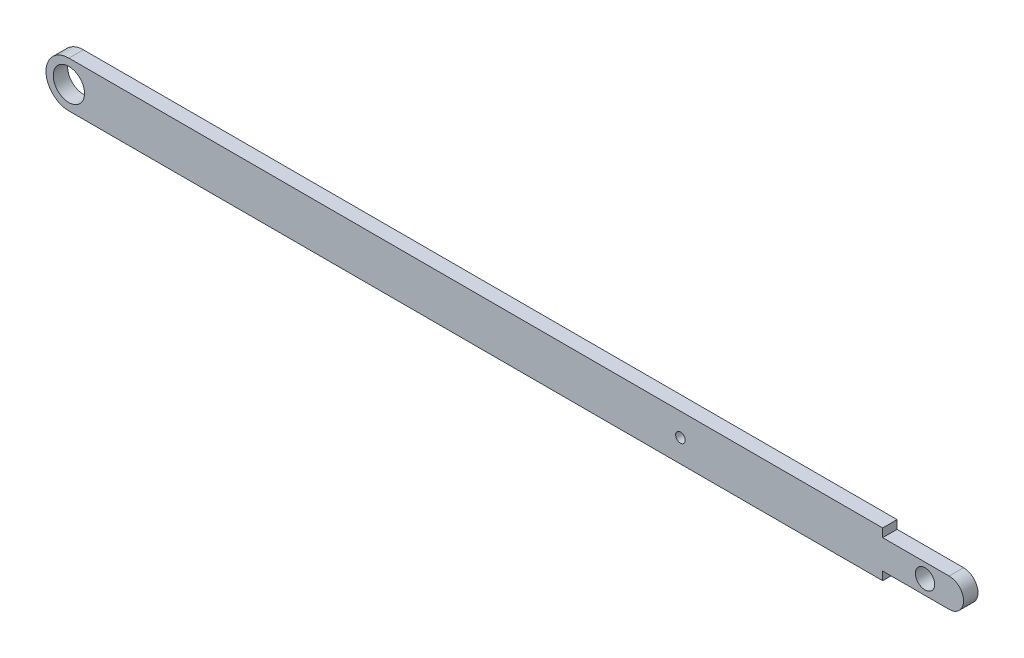
from build123d import *

# Parameters (mm, degrees)
BOSS_EXTRUDE1_DEPTH = 1.5
SKETCH2_R           = 3.25
SKETCH2_R_2         = 1
SKETCH2_R_3         = 2
CUT_EXTRUDE1_DEPTH  = 20


with BuildPart() as part:
    # Sketch1 → Boss-Extrude1 (new, symmetric)
    with BuildSketch(Plane.XY):
        with BuildLine():
            Line((0, -4.75), (169, -4.75))
            Line((169, -4.75), (169, -3))
            Line((169, -3), (182.8, -3))
            ThreePointArc((182.8, -3), (185.8, 0), (182.8, 3))
            Line((182.8, 3), (169, 3))
            Line((169, 3), (169, 4.75))
            Line((169, 4.75), (0, 4.75))
            ThreePointArc((0, 4.75), (-4.75, 0), (0, -4.75))
        make_face()
    extrude(amount=BOSS_EXTRUDE1_DEPTH, both=True)

    # Sketch2 → Cut-Extrude1 (cut, symmetric)
    with BuildSketch(Plane.XY):
        Circle(SKETCH2_R)
        with Locations((127, 0)):
            Circle(SKETCH2_R_2)
        with Locations((177.8, 0)):
            Circle(SKETCH2_R_3)
    extrude(amount=CUT_EXTRUDE1_DEPTH, both=True, mode=Mode.SUBTRACT)


solid = part.part
